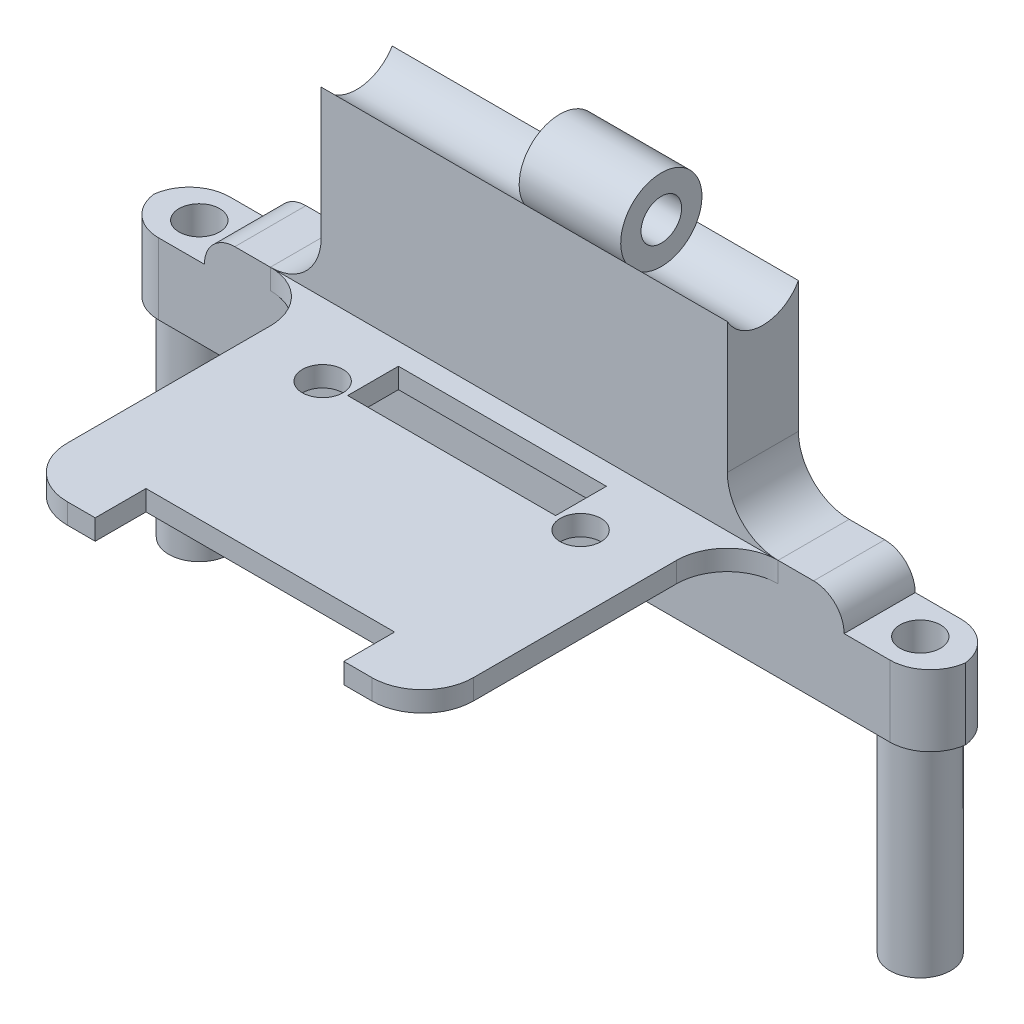
from build123d import *

# Parameters (mm, degrees)
SKETCH1_W           = 80
SKETCH1_H           = 7
BOSS_EXTRUDE1_DEPTH = 30
SKETCH2_R           = 3
SKETCH2_R_2         = 2
BOSS_EXTRUDE2_DEPTH = 20
SKETCH7_W           = 20
SKETCH7_H           = 20
CUT_EXTRUDE1_DEPTH  = 52.941693496
SKETCH9_R           = 4.1
CUT_EXTRUDE2_DEPTH  = 68.885232888
SKETCH11_R          = 4
SKETCH11_R_2        = 2
BOSS_EXTRUDE6_DEPTH = 20
FILLET1_R           = 5
FILLET2_R           = 4
SKETCH14_W          = 40
SKETCH14_H          = 2
BOSS_EXTRUDE8_DEPTH = 30
FILLET4_START       = 8
FILLET4_DEPTH       = 2
FILLET4_2_DEPTH     = 2
SKETCH15_R          = 2
CUT_EXTRUDE3_DEPTH  = 58.907259499
SKETCH16_W          = 20.48
SKETCH16_H          = 5
SKETCH16_W_2        = 24.48
CUT_EXTRUDE4_DEPTH  = 58.907259499
SKETCH11_2_R        = 4
SKETCH11_2_R_2      = 2
CUT_EXTRUDE5_DEPTH  = 10
CUT_EXTRUDE6_REACH  = 61.965
SKETCH17_R          = 2
CUT_EXTRUDE7_START  = -3
CUT_EXTRUDE7_DEPTH  = 3
FILLET5_R           = 3


with BuildPart() as part:
    # Sketch1 → Boss-Extrude1 (new body)
    with BuildSketch(Plane(origin=(0, 0, 0), x_dir=(1, 0, 0), z_dir=(0, 1, 0))):
        with Locations((1.820324284, 6.911764706)):
            Rectangle(SKETCH1_W, SKETCH1_H)
    extrude(amount=BOSS_EXTRUDE1_DEPTH)

    # Sketch2 → Boss-Extrude2 (add)
    # profile 1 of 2: a face of its own
    with BuildSketch(Plane.XZ):
        with Locations(Location((-33.679675716, -6.911764706, 0), (0, 0, 270))):
            Circle(SKETCH2_R)
        with Locations(Location((-33.679675716, -6.911764706, 0), (0, 0, 270))):
            Circle(SKETCH2_R_2, mode=Mode.SUBTRACT)
    # profile 2 of 2: a face of its own
    with BuildSketch(Plane.XZ):
        with Locations(Location((37.320324284, -6.911764706, 0), (0, 0, 270))):
            Circle(SKETCH2_R)
        with Locations(Location((37.320324284, -6.911764706, 0), (0, 0, 270))):
            Circle(SKETCH2_R_2, mode=Mode.SUBTRACT)
    extrude(amount=BOSS_EXTRUDE2_DEPTH)

    # Sketch7 → Cut-Extrude1 (cut, through all)
    with BuildSketch(Plane(origin=(0, 0, -10.411764706), x_dir=(-1, 0, 0), z_dir=(0, 0, -1))):
        with Locations((-31.820324284, 20)):
            Rectangle(SKETCH7_W, SKETCH7_H)
        with Locations((28.179675716, 20)):
            Rectangle(SKETCH7_W, SKETCH7_H)
    extrude(amount=-CUT_EXTRUDE1_DEPTH, mode=Mode.SUBTRACT)

    # Sketch9 → Cut-Extrude2 (cut, through all)
    with BuildSketch(Plane.ZY.offset(18.179675716)):
        with Locations((-6.911764706, 30)):
            Circle(SKETCH9_R)
    extrude(amount=-CUT_EXTRUDE2_DEPTH, mode=Mode.SUBTRACT)

    # Sketch11 → Boss-Extrude6 (add)
    with BuildSketch(Plane(origin=(21.820324284, 0, 0), x_dir=(0, 0, -1), z_dir=(1, 0, 0))):
        with Locations((6.911764706, 29.801076023)):
            Circle(SKETCH11_R)
        with Locations((6.911764706, 29.801076023)):
            Circle(SKETCH11_R_2, mode=Mode.SUBTRACT)
    extrude(amount=-BOSS_EXTRUDE6_DEPTH)

    # Fillet1
    fillet1_edges = [part.edges().sort_by_distance(p)[0] for p in [
        (21.820324284, 10, -6.911764706),
        (-18.179675716, 10, -6.911764706),
    ]]
    fillet(fillet1_edges, radius=FILLET1_R)

    # Fillet2
    # the kernel refuses this fillet: 4 mm, written as the material it takes off along each edge
    with BuildSketch(Plane(origin=(41.820324284, -10, -10.411764706), x_dir=(-1, 0, 0), z_dir=(0, 1, 0)), Plane(origin=(41.820324284, -10, -3.411764706), x_dir=(0, 0, -1), z_dir=(0, 1, 0))) as fillet2_piece_1:
        with BuildLine():
            CenterArc((FILLET2_R, FILLET2_R), FILLET2_R, 180, 90)
            Line((0, FILLET2_R), (0, 0))
            Line((0, 0), (FILLET2_R, 0))
        make_face()
    extrude(amount=30, mode=Mode.SUBTRACT)
    with BuildSketch(Plane(origin=(-38.179675716, -10, -3.411764706), x_dir=(0, 0, -1), z_dir=(0, 1, 0)), Plane(origin=(-38.179675716, -10, -10.411764706), x_dir=(1, 0, 0), z_dir=(0, 1, 0))) as fillet2_piece_2:
        with BuildLine():
            CenterArc((FILLET2_R, -FILLET2_R), FILLET2_R, 90, 90)
            Line((0, -FILLET2_R), (0, 0))
            Line((0, 0), (FILLET2_R, 0))
        make_face()
    extrude(amount=30, mode=Mode.SUBTRACT)

    # Sketch14 → Boss-Extrude8 (add)
    with BuildSketch(Plane.XY.offset(-3.411764706)):
        with Locations((1.820324284, 9)):
            Rectangle(SKETCH14_W, SKETCH14_H)
    extrude(amount=BOSS_EXTRUDE8_DEPTH)

    # Fillet4: read off the stored shape, not the designer's step
    # Fillet4 outline → Fillet4 (cut)
    with BuildSketch(Plane(origin=(0, 0, 0), x_dir=(1, 0, 0), z_dir=(0, 1, 0)).offset(FILLET4_START)):
        with BuildLine():
            Line((-18.179675716, -26.588235294), (-13.179675716, -26.588235294))
            ThreePointArc((-13.179675716, -26.588235294), (-16.715209622, -25.1237692), (-18.179675716, -21.588235294))
            Line((-18.179675716, -21.588235294), (-18.179675716, -26.588235294))
        make_face()
        with BuildLine():
            ThreePointArc((21.820324284, -21.588235294), (20.35585819, -25.123769199), (16.820324284, -26.588235294))
            Line((16.820324284, -26.588235294), (21.820324284, -26.588235294))
            Line((21.820324284, -26.588235294), (21.820324284, -21.588235294))
        make_face()
    extrude(amount=FILLET4_DEPTH, mode=Mode.SUBTRACT)

    # Fillet4 2 outline → Fillet4 2 (add)
    with BuildSketch(Plane(origin=(0, 0, 0), x_dir=(1, 0, 0), z_dir=(0, 1, 0)).offset(FILLET4_START)):
        with BuildLine():
            ThreePointArc((-23.179675716, 3.411764706), (-19.64414181, 1.947298611), (-18.179675716, -1.588235294))
            Line((-18.179675716, -1.588235294), (-18.179675716, 3.411764706))
            Line((-18.179675716, 3.411764706), (-23.179675716, 3.411764706))
        make_face()
        with BuildLine():
            Line((21.820324284, 3.411764706), (21.820324284, -1.588235294))
            ThreePointArc((21.820324284, -1.588235294), (23.284790378, 1.947298612), (26.820324284, 3.411764706))
            Line((26.820324284, 3.411764706), (21.820324284, 3.411764706))
        make_face()
    extrude(amount=FILLET4_2_DEPTH)

    # Sketch15 → Cut-Extrude3 (cut, through all)
    with BuildSketch(Plane(origin=(0, 10, 0), x_dir=(1, 0, 0), z_dir=(0, 1, 0))):
        with Locations(Location((-10.889675716, -3.728235294, 0), (0, 0, 180))):
            Circle(SKETCH15_R)
        with Locations(Location((14.510324284, -3.728235294, 0), (0, 0, 180))):
            Circle(SKETCH15_R)
    extrude(amount=-CUT_EXTRUDE3_DEPTH, mode=Mode.SUBTRACT)

    # Sketch16 → Cut-Extrude4 (cut, through all)
    with BuildSketch(Plane(origin=(0, 10, 0), x_dir=(1, 0, 0), z_dir=(0, 1, 0))):
        with Locations((1.810324284, -1.228235294)):
            Rectangle(SKETCH16_W, SKETCH16_H)
        with Locations((1.810324284, -24.088235294)):
            Rectangle(SKETCH16_W_2, SKETCH16_H)
    extrude(amount=-CUT_EXTRUDE4_DEPTH, mode=Mode.SUBTRACT)

    # Sketch11<2> → Cut-Extrude5 (cut)
    with BuildSketch(Plane(origin=(21.820324284, 0, 0), x_dir=(0, 0, -1), z_dir=(1, 0, 0))):
        with Locations((6.911764706, 29.801076023)):
            Circle(SKETCH11_2_R)
        with Locations((6.911764706, 29.801076023)):
            Circle(SKETCH11_2_R_2, mode=Mode.SUBTRACT)
    extrude(amount=-CUT_EXTRUDE5_DEPTH, mode=Mode.SUBTRACT)

    # Sketch17 → Cut-Extrude6 (cut, up to next)
    with BuildSketch(Plane.XZ, mode=Mode.PRIVATE) as cut_extrude6_sk1:
        with Locations(Location((37.320324284, -6.911764706, 0), (0, 0, 270))):
            Circle(SKETCH17_R)
    cut_extrude6_tool1 = extrude(cut_extrude6_sk1.sketch, amount=-CUT_EXTRUDE6_REACH, mode=Mode.PRIVATE) & part.part
    # Sketch17 → Cut-Extrude6 (cut, up to next)
    with BuildSketch(Plane.XZ, mode=Mode.PRIVATE) as cut_extrude6_sk2:
        with Locations((-33.679675716, -6.911764706)):
            Circle(SKETCH17_R)
    cut_extrude6_tool2 = extrude(cut_extrude6_sk2.sketch, amount=-CUT_EXTRUDE6_REACH, mode=Mode.PRIVATE) & part.part
    add(cut_extrude6_tool1.solids().sort_by_distance((37.320324, 0, -6.911765))[0], mode=Mode.SUBTRACT)
    add(cut_extrude6_tool2.solids().sort_by_distance((-33.679676, 0, -6.911765))[0], mode=Mode.SUBTRACT)

    # Sketch18 → Cut-Extrude7 (cut)
    with BuildSketch(Plane(origin=(0, 10, 0), x_dir=(1, 0, 0), z_dir=(0, 1, 0)).offset(CUT_EXTRUDE7_START)):
        with BuildLine():
            Line((37.820324284, 10.411764706), (33.320324284, 10.411764706))
            Line((33.320324284, 10.411764706), (33.320324284, 3.411764706))
            Line((33.320324284, 3.411764706), (37.820324284, 3.411764706))
            ThreePointArc((37.820324284, 3.411764706), (40.466075595, 4.411764706), (41.78895125, 6.911764706))
            ThreePointArc((41.78895125, 6.911764706), (40.466075595, 9.411764706), (37.820324284, 10.411764706))
        make_face()
        with BuildLine():
            Line((-34.179675716, 3.411764706), (-29.679675716, 3.411764706))
            Line((-29.679675716, 3.411764706), (-29.679675716, 10.411764706))
            Line((-29.679675716, 10.411764706), (-34.179675716, 10.411764706))
            ThreePointArc((-34.179675716, 10.411764706), (-36.825427028, 9.411764706), (-38.148302683, 6.911764706))
            ThreePointArc((-38.148302683, 6.911764706), (-36.825427028, 4.411764706), (-34.179675716, 3.411764706))
        make_face()
    extrude(amount=CUT_EXTRUDE7_DEPTH, mode=Mode.SUBTRACT)

    # Fillet5
    fillet5_edges = [part.edges().sort_by_distance(p)[0] for p in [
        (-29.679675716, 10, -6.911764706),
        (33.320324284, 10, -6.911764706),
    ]]
    fillet(fillet5_edges, radius=FILLET5_R - 0.0001)  # a hair under: the kernel refuses the full size


solid = part.part
